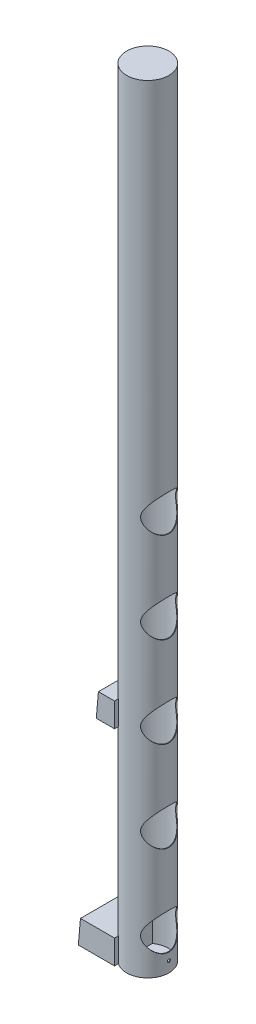
from build123d import *

# Parameters (mm, degrees)
SKETCH_2_R               = 35
SKETCH_2_R_2             = 34
EXTRUDE_1_DEPTH          = 1285
EXTRUDE_START            = 1
SKETCH_3_R               = 35
EXTRUDE_2_DEPTH          = 1
SKETCH_4_R               = 35
EXTRUDE_3_DEPTH          = 1
SKETCH_5_R               = 2.5
SKETCH_5_R_2             = 30
CUT_EXTRUDE_1_DEPTH      = 1287.952213565
SKETCH_6_R               = 10
CUT_EXTRUDE_2_DEPTH      = 1287.95221367
EXTRUDE_START_2          = -20
SKETCH_7_W               = 70
SKETCH_7_H               = 40
EXTRUDE_4_DEPTH          = 60
EXTRUDE_START_3          = -50
SKETCH_8_W               = 70
SKETCH_8_H               = 40
EXTRUDE_5_DEPTH          = 30
CUT_EXTRUDE_3_DEPTH      = 1289.961209759
CUT_EXTRUDE_3_DEPTH_BACK = 1289.961209759


with BuildPart() as part:
    # Эскиз2 → Бобышка-Вытянуть1 (new body)
    with BuildSketch(Plane(origin=(0, 0, 0), x_dir=(1, 0, 0), z_dir=(0, 1, 0))):
        Circle(SKETCH_2_R)
        Circle(SKETCH_2_R_2, mode=Mode.SUBTRACT)
    extrude(amount=EXTRUDE_1_DEPTH)

    # Эскиз3 → Бобышка-Вытянуть2 (add)
    with BuildSketch(Plane.XZ.offset(EXTRUDE_START)):
        Circle(SKETCH_3_R)
    extrude(amount=-EXTRUDE_2_DEPTH)

    # Эскиз4 → Бобышка-Вытянуть3 (add)
    with BuildSketch(Plane(origin=(0, 1285, 0), x_dir=(1, 0, 0), z_dir=(0, 1, 0))):
        Circle(SKETCH_4_R)
    extrude(amount=EXTRUDE_3_DEPTH)

    # Эскиз5 → Вырез-Вытянуть1 (cut, through all)
    with BuildSketch(Plane(origin=(0, 0, 0), x_dir=(0, 0, -1), z_dir=(1, 0, 0))):
        with Locations((0, 16.5)):
            Circle(SKETCH_5_R)
        with Locations((0, 59)):
            Circle(SKETCH_5_R_2)
        with Locations((0, 209)):
            Circle(SKETCH_5_R_2)
        with Locations((0, 359)):
            Circle(SKETCH_5_R_2)
        with Locations((0, 509)):
            Circle(SKETCH_5_R_2)
        with Locations((0, 659)):
            Circle(SKETCH_5_R_2)
    extrude(amount=CUT_EXTRUDE_1_DEPTH, mode=Mode.SUBTRACT)

    # Эскиз6 → Вырез-Вытянуть2 (cut, through all)
    with BuildSketch(Plane(origin=(0, 0, 0), x_dir=(0, 0, -1), z_dir=(1, 0, 0))):
        with Locations((0, 1271)):
            Circle(SKETCH_6_R)
    extrude(amount=-CUT_EXTRUDE_2_DEPTH, mode=Mode.SUBTRACT)

    # Эскиз7 → Бобышка-Вытянуть4 (add)
    with BuildSketch(Plane(origin=(0, 0, 0), x_dir=(0, 0, -1), z_dir=(1, 0, 0)).offset(EXTRUDE_START_2)):
        with Locations((0, 19)):
            Rectangle(SKETCH_7_W, SKETCH_7_H)
    extrude(amount=-EXTRUDE_4_DEPTH)

    # Эскиз8 → Бобышка-Вытянуть5 (add)
    with BuildSketch(Plane(origin=(0, 0, 0), x_dir=(0, 0, -1), z_dir=(1, 0, 0)).offset(EXTRUDE_START_3)):
        with Locations((0, 359)):
            Rectangle(SKETCH_8_W, SKETCH_8_H)
    extrude(amount=EXTRUDE_5_DEPTH)

    # Эскиз9 → Вырез-Вытянуть3 (cut, two sides: drawn at the far end of the back side and taken through both)
    with BuildSketch(Plane.XY.offset(-CUT_EXTRUDE_3_DEPTH_BACK)):
        Polygon((-80, -1), (-76.500453459, 39), (-80, 39), align=None)
        Polygon((-50.253854401, 339), (-46.75430786, 379), (-50, 379), align=None)
    extrude(amount=CUT_EXTRUDE_3_DEPTH + CUT_EXTRUDE_3_DEPTH_BACK, mode=Mode.SUBTRACT)


solid = part.part
